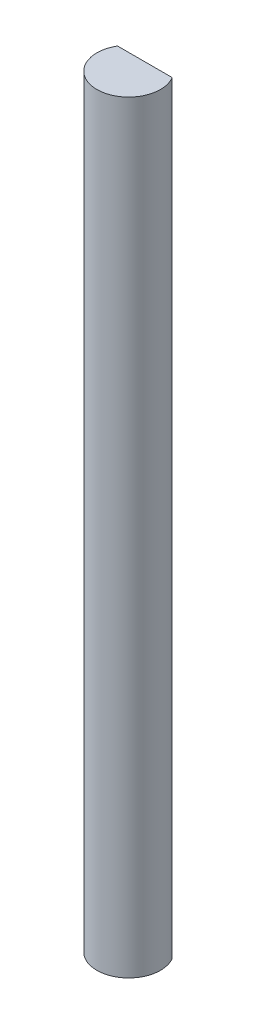
from build123d import *

# Parameters (mm, degrees)
BOSS_EXTRUDE1_DEPTH = 76.2


with BuildPart() as part:
    # Sketch1 → Boss-Extrude1 (new body)
    with BuildSketch(Plane(origin=(0, 0, 0), x_dir=(1, 0, 0), z_dir=(0, 1, 0))):
        with BuildLine():
            Line((2.730888358, 1.619528874), (-2.730888358, 1.619528874))
            ThreePointArc((-2.730888358, 1.619528874), (-0.839658997, -3.061959792), (3.175, 0))
            ThreePointArc((3.175, 0), (3.061959792, 0.839658997), (2.730888358, 1.619528874))
        make_face()
    extrude(amount=BOSS_EXTRUDE1_DEPTH)


solid = part.part
